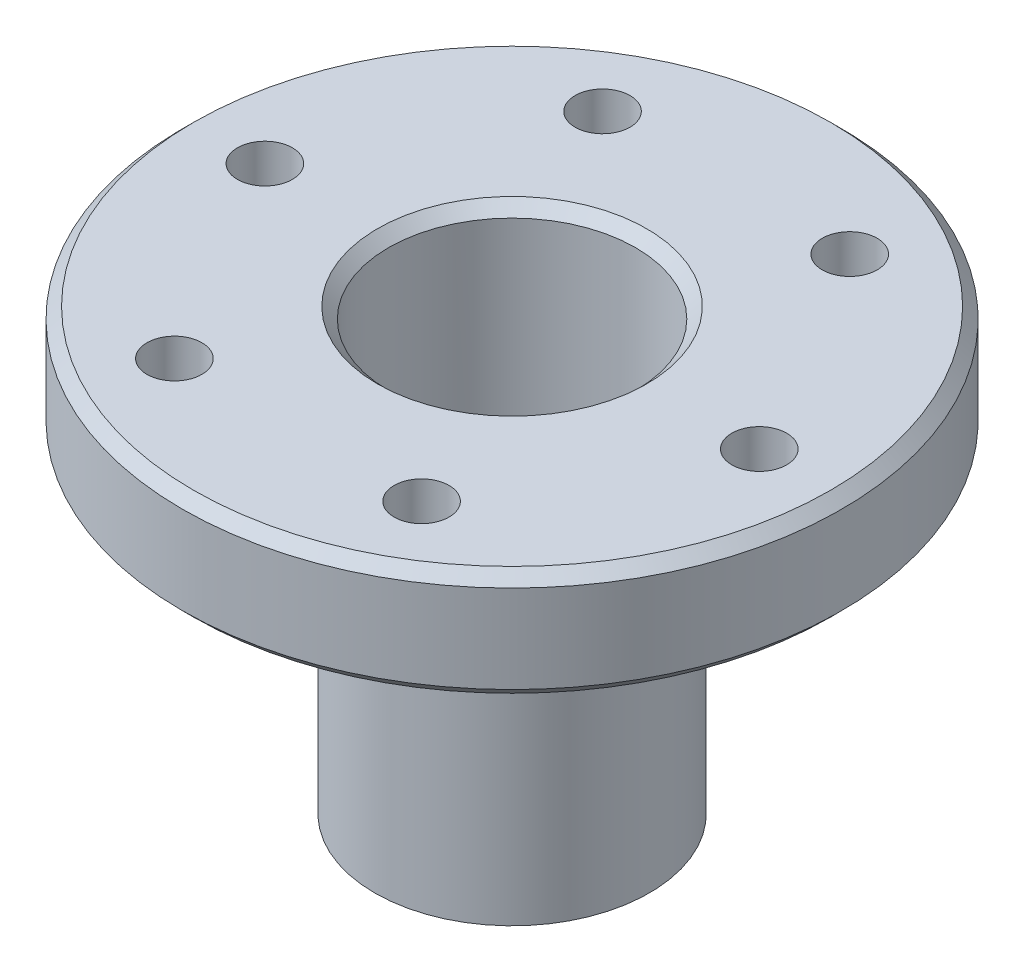
from build123d import *

# Parameters (mm, degrees)
SKETCH1_R           = 60
SKETCH1_R_2         = 22.5
SKETCH1_R_3         = 5
BOSS_EXTRUDE1_DEPTH = 20
CHAMFER1_SIZE       = 2
BOSS_EXTRUDE2_START = 60
SKETCH2_R           = 25
SKETCH2_R_2         = 22.5
BOSS_EXTRUDE2_DEPTH = 60
CHAMFER2_SIZE       = 2


with BuildPart() as part:
    # Sketch1 → Boss-Extrude1 (new body)
    with BuildSketch(Plane(origin=(0, 0, 0), x_dir=(1, 0, 0), z_dir=(0, 1, 0))):
        Circle(SKETCH1_R)
        Circle(SKETCH1_R_2, mode=Mode.SUBTRACT)
        with Locations((45, 0)):
            Circle(SKETCH1_R_3, mode=Mode.SUBTRACT)
        with Locations((22.5, -38.97114317)):
            Circle(SKETCH1_R_3, mode=Mode.SUBTRACT)
        with Locations((-22.5, -38.97114317)):
            Circle(SKETCH1_R_3, mode=Mode.SUBTRACT)
        with Locations((-45, 0)):
            Circle(SKETCH1_R_3, mode=Mode.SUBTRACT)
        with Locations((-22.5, 38.97114317)):
            Circle(SKETCH1_R_3, mode=Mode.SUBTRACT)
        with Locations((22.5, 38.97114317)):
            Circle(SKETCH1_R_3, mode=Mode.SUBTRACT)
    extrude(amount=BOSS_EXTRUDE1_DEPTH)

    # Chamfer1
    chamfer1_edges = [part.edges().sort_by_distance(p)[0] for p in [
        (-60, 0, 0),
        (-22.5, 20, 0),
        (-60, 20, 0),
    ]]
    chamfer(chamfer1_edges, length=CHAMFER1_SIZE)

    # Sketch2 → Boss-Extrude2 (add)
    with BuildSketch(Plane.XZ.offset(BOSS_EXTRUDE2_START)):
        Circle(SKETCH2_R)
        Circle(SKETCH2_R_2, mode=Mode.SUBTRACT)
    extrude(amount=-BOSS_EXTRUDE2_DEPTH)

    # Chamfer2
    chamfer2_edges = [part.edges().sort_by_distance(p)[0] for p in [
        (-22.5, -60, 0),
    ]]
    chamfer(chamfer2_edges, length=CHAMFER2_SIZE)


solid = part.part
